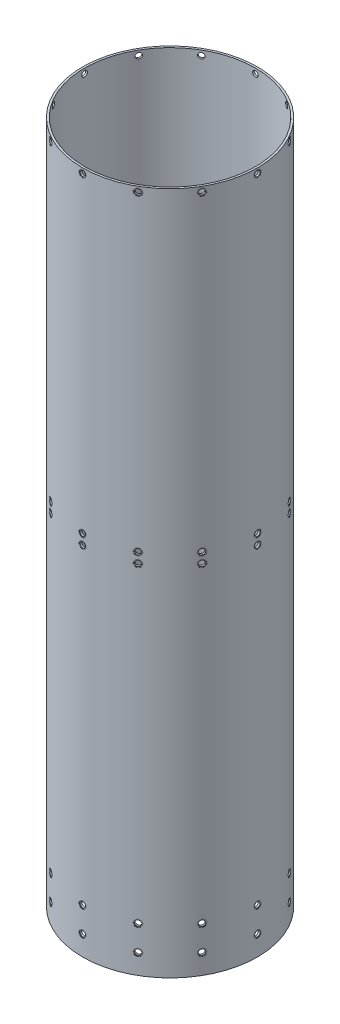
from build123d import *

# Parameters (mm, degrees)
SZKIC1_R                        = 87
SZKIC1_R_2                      = 85
DODANIE_WYCI_GNI_CIE2_DEPTH     = 680
WYTNIJ_WYCI_GNI_CIE1_REACH      = 709.28
WYTNIJ_WYCI_GNI_CIE1_END_RADIUS = 85
SZKIC3_R                        = 2.75
SZYK_KO_OWY1_COUNT              = 12
SZKIC4_R                        = 3.55
WYTNIJ_WYCI_GNI_CIE2_DEPTH      = 0.2
SZYK_KO_OWY2_COUNT              = 12
WYTNIJ_WYCI_GNI_CIE3_REACH      = 709.28
WYTNIJ_WYCI_GNI_CIE3_END_RADIUS = 85
SZKIC5_R                        = 2.75
SZKIC5_3_R                      = 3.55
SZKIC5_3_R_2                    = 2.75
WYTNIJ_WYCI_GNI_CIE4_DEPTH      = 0.2
SZYK_KO_OWY3_COUNT              = 12
SZYK_START                      = -87.000000044
SZYK_LINIOWY1_OUTLINE_R         = 2.75
SZYK_LINIOWY1_DEPTH             = 174.000000088
SZYK_LINIOWY1_2_OUTLINE_R       = 3.55
SZYK_LINIOWY1_2_OUTLINE_R_2     = 2.75
SZYK_LINIOWY1_2_DEPTH           = 0.200000044
SZYK_START_2                    = 86.8
SZYK_LINIOWY1_3_OUTLINE_R       = 3.55
SZYK_LINIOWY1_3_OUTLINE_R_2     = 2.75
SZYK_LINIOWY1_3_DEPTH           = 0.200000044
SZYK_LINIOWY1_4_OUTLINE_R       = 2.75
SZYK_LINIOWY1_4_DEPTH           = 174.000000088
SZYK_LINIOWY1_5_OUTLINE_R       = 3.55
SZYK_LINIOWY1_5_OUTLINE_R_2     = 2.75
SZYK_LINIOWY1_5_DEPTH           = 0.200000044
SZYK_LINIOWY1_6_OUTLINE_R       = 3.55
SZYK_LINIOWY1_6_OUTLINE_R_2     = 2.75
SZYK_LINIOWY1_6_DEPTH           = 0.200000044
SZYK_START_3                    = -87.000000101
SZYK_LINIOWY1_7_OUTLINE_R       = 2.75
SZYK_LINIOWY1_7_DEPTH           = 174.000000145
SZYK_LINIOWY1_8_OUTLINE_R       = 3.55
SZYK_LINIOWY1_8_OUTLINE_R_2     = 2.75
SZYK_LINIOWY1_8_DEPTH           = 0.200000101
SZYK_LINIOWY1_9_OUTLINE_R       = 3.55
SZYK_LINIOWY1_9_OUTLINE_R_2     = 2.75
SZYK_LINIOWY1_9_DEPTH           = 0.200000044
SZYK_LINIOWY1_10_OUTLINE_R      = 2.75
SZYK_LINIOWY1_10_DEPTH          = 174.000000088
SZYK_LINIOWY1_11_OUTLINE_R      = 3.55
SZYK_LINIOWY1_11_OUTLINE_R_2    = 2.75
SZYK_LINIOWY1_11_DEPTH          = 0.200000044
SZYK_LINIOWY1_12_OUTLINE_R      = 3.55
SZYK_LINIOWY1_12_OUTLINE_R_2    = 2.75
SZYK_LINIOWY1_12_DEPTH          = 0.200000044
SZYK_LINIOWY1_13_OUTLINE_R      = 2.75
SZYK_LINIOWY1_13_DEPTH          = 174.000000088
SZYK_LINIOWY1_14_OUTLINE_R      = 3.55
SZYK_LINIOWY1_14_OUTLINE_R_2    = 2.75
SZYK_LINIOWY1_14_DEPTH          = 0.200000044
SZYK_LINIOWY1_15_OUTLINE_R      = 3.55
SZYK_LINIOWY1_15_OUTLINE_R_2    = 2.75
SZYK_LINIOWY1_15_DEPTH          = 0.200000044
SZYK_LINIOWY1_16_OUTLINE_R      = 2.75
SZYK_LINIOWY1_16_DEPTH          = 174.000000088
SZYK_LINIOWY1_17_OUTLINE_R      = 3.55
SZYK_LINIOWY1_17_OUTLINE_R_2    = 2.75
SZYK_LINIOWY1_17_DEPTH          = 0.200000044
SZYK_LINIOWY1_18_OUTLINE_R      = 3.55
SZYK_LINIOWY1_18_OUTLINE_R_2    = 2.75
SZYK_LINIOWY1_18_DEPTH          = 0.200000044
SZYK_LINIOWY2_OUTLINE_R         = 2.75
SZYK_LINIOWY2_DEPTH             = 174.000000088
SZYK_LINIOWY2_2_OUTLINE_R       = 3.55
SZYK_LINIOWY2_2_OUTLINE_R_2     = 2.75
SZYK_LINIOWY2_2_DEPTH           = 0.200000044
SZYK_LINIOWY2_3_OUTLINE_R       = 3.55
SZYK_LINIOWY2_3_OUTLINE_R_2     = 2.75
SZYK_LINIOWY2_3_DEPTH           = 0.200000044
SZYK_LINIOWY2_4_OUTLINE_R       = 2.75
SZYK_LINIOWY2_4_DEPTH           = 174.000000088
SZYK_LINIOWY2_5_OUTLINE_R       = 3.55
SZYK_LINIOWY2_5_OUTLINE_R_2     = 2.75
SZYK_LINIOWY2_5_DEPTH           = 0.200000044
SZYK_LINIOWY2_6_OUTLINE_R       = 3.55
SZYK_LINIOWY2_6_OUTLINE_R_2     = 2.75
SZYK_LINIOWY2_6_DEPTH           = 0.200000044
SZYK_LINIOWY2_7_OUTLINE_R       = 2.75
SZYK_LINIOWY2_7_DEPTH           = 174.000000145
SZYK_LINIOWY2_8_OUTLINE_R       = 3.55
SZYK_LINIOWY2_8_OUTLINE_R_2     = 2.75
SZYK_LINIOWY2_8_DEPTH           = 0.200000101
SZYK_LINIOWY2_9_OUTLINE_R       = 3.55
SZYK_LINIOWY2_9_OUTLINE_R_2     = 2.75
SZYK_LINIOWY2_9_DEPTH           = 0.200000044
SZYK_LINIOWY2_10_OUTLINE_R      = 2.75
SZYK_LINIOWY2_10_DEPTH          = 174.000000088
SZYK_LINIOWY2_11_OUTLINE_R      = 3.55
SZYK_LINIOWY2_11_OUTLINE_R_2    = 2.75
SZYK_LINIOWY2_11_DEPTH          = 0.200000044
SZYK_LINIOWY2_12_OUTLINE_R      = 3.55
SZYK_LINIOWY2_12_OUTLINE_R_2    = 2.75
SZYK_LINIOWY2_12_DEPTH          = 0.200000044
SZYK_LINIOWY2_13_OUTLINE_R      = 2.75
SZYK_LINIOWY2_13_DEPTH          = 174.000000088
SZYK_LINIOWY2_14_OUTLINE_R      = 3.55
SZYK_LINIOWY2_14_OUTLINE_R_2    = 2.75
SZYK_LINIOWY2_14_DEPTH          = 0.200000044
SZYK_LINIOWY2_15_OUTLINE_R      = 3.55
SZYK_LINIOWY2_15_OUTLINE_R_2    = 2.75
SZYK_LINIOWY2_15_DEPTH          = 0.200000044
SZYK_LINIOWY2_16_OUTLINE_R      = 2.75
SZYK_LINIOWY2_16_DEPTH          = 174.000000088
SZYK_LINIOWY2_17_OUTLINE_R      = 3.55
SZYK_LINIOWY2_17_OUTLINE_R_2    = 2.75
SZYK_LINIOWY2_17_DEPTH          = 0.200000044
SZYK_LINIOWY2_18_OUTLINE_R      = 3.55
SZYK_LINIOWY2_18_OUTLINE_R_2    = 2.75
SZYK_LINIOWY2_18_DEPTH          = 0.200000044


# Read off the part's stored shape, not the designer's step: Szyk liniowy1, Szyk liniowy2
with BuildPart() as part:
    # Szkic1 → Dodanie-wyciągnięcie2 (new body)
    with BuildSketch(Plane(origin=(0, 0, 0), x_dir=(1, 0, 0), z_dir=(0, 1, 0))):
        with Locations(Location((0, 0, 0), (0, 0, 270))):
            Circle(SZKIC1_R)
        with Locations(Location((0, 0, 0), (0, 0, 270))):
            Circle(SZKIC1_R_2, mode=Mode.SUBTRACT)
    extrude(amount=DODANIE_WYCI_GNI_CIE2_DEPTH)

    # Wytnij-wyciągnięcie1: up to this cylinder (the profile starts outside it)
    wytnij_wyci_gni_cie1_end = Plane(origin=(0, 32.5, 0), z_dir=(0, -1, 0)) * Cylinder(WYTNIJ_WYCI_GNI_CIE1_END_RADIUS, 1614.56, mode=Mode.PRIVATE)
    # Szkic3 → Wytnij-wyciągnięcie1 (cut, up to the surface)
    with BuildSketch(Plane.XY.offset(87), mode=Mode.PRIVATE) as wytnij_wyci_gni_cie1_sk1:
        with Locations((0, 20)):
            Circle(SZKIC3_R)
    wytnij_wyci_gni_cie1_tool1 = extrude(wytnij_wyci_gni_cie1_sk1.sketch, amount=-WYTNIJ_WYCI_GNI_CIE1_REACH, mode=Mode.PRIVATE) - wytnij_wyci_gni_cie1_end
    # Szkic3 → Wytnij-wyciągnięcie1 (cut, up to the surface)
    with BuildSketch(Plane.XY.offset(87), mode=Mode.PRIVATE) as wytnij_wyci_gni_cie1_sk2:
        with Locations((0, 45)):
            Circle(SZKIC3_R)
    wytnij_wyci_gni_cie1_tool2 = extrude(wytnij_wyci_gni_cie1_sk2.sketch, amount=-WYTNIJ_WYCI_GNI_CIE1_REACH, mode=Mode.PRIVATE) - wytnij_wyci_gni_cie1_end
    wytnij_wyci_gni_cie1 = wytnij_wyci_gni_cie1_tool1.solids().sort_by_distance((0, 20, 87))[0] + wytnij_wyci_gni_cie1_tool2.solids().sort_by_distance((0, 45, 87))[0]
    add(wytnij_wyci_gni_cie1, mode=Mode.SUBTRACT)

    # Szyk kołowy1: Wytnij-wyciągnięcie1 ×12 about axis
    szyk_ko_owy1_axis = Axis((0, 680, 0), (0, -1, 0))
    for i in range(1, SZYK_KO_OWY1_COUNT):
        add(wytnij_wyci_gni_cie1.rotate(szyk_ko_owy1_axis, i * 360 / SZYK_KO_OWY1_COUNT), mode=Mode.SUBTRACT)

    # Szkic4 → Wytnij-wyciągnięcie2 (cut)
    with BuildSketch(Plane.XY.offset(87)):
        with Locations((0, 45)):
            Circle(SZKIC4_R)
        with Locations((0, 20)):
            Circle(SZKIC4_R)
    wytnij_wyci_gni_cie2 = extrude(amount=-WYTNIJ_WYCI_GNI_CIE2_DEPTH, mode=Mode.SUBTRACT)

    # Szyk kołowy2: Wytnij-wyciągnięcie2 ×12 about axis
    szyk_ko_owy2_axis = Axis((0, 0, 0), (0, 1, 0))
    for i in range(1, SZYK_KO_OWY2_COUNT):
        add(wytnij_wyci_gni_cie2.rotate(szyk_ko_owy2_axis, i * 360 / SZYK_KO_OWY2_COUNT), mode=Mode.SUBTRACT)

    # Wytnij-wyciągnięcie3: up to this cylinder (the profile starts outside it)
    wytnij_wyci_gni_cie3_end = Plane(origin=(0, 355.02, 0), z_dir=(0, -1, 0)) * Cylinder(WYTNIJ_WYCI_GNI_CIE3_END_RADIUS, 1589.56, mode=Mode.PRIVATE)
    # Szkic5 → Wytnij-wyciągnięcie3 (cut, up to the surface)
    with BuildSketch(Plane.XY.offset(87), mode=Mode.PRIVATE) as wytnij_wyci_gni_cie3_sk1:
        with Locations((0, 355.02)):
            Circle(SZKIC5_R)
    wytnij_wyci_gni_cie3_tool1 = extrude(wytnij_wyci_gni_cie3_sk1.sketch, amount=-WYTNIJ_WYCI_GNI_CIE3_REACH, mode=Mode.PRIVATE) - wytnij_wyci_gni_cie3_end
    wytnij_wyci_gni_cie3 = wytnij_wyci_gni_cie3_tool1.solids().sort_by_distance((0, 355.02, 87))[0]
    add(wytnij_wyci_gni_cie3, mode=Mode.SUBTRACT)

    # Szkic5<3> → Wytnij-wyciągnięcie4 (cut)
    with BuildSketch(Plane.XY.offset(87)):
        with Locations((0, 355.02)):
            Circle(SZKIC5_3_R)
        with Locations((0, 355.02)):
            Circle(SZKIC5_3_R_2, mode=Mode.SUBTRACT)
    wytnij_wyci_gni_cie4 = extrude(amount=-WYTNIJ_WYCI_GNI_CIE4_DEPTH, mode=Mode.SUBTRACT)

    # Szyk kołowy3: Wytnij-wyciągnięcie3, Wytnij-wyciągnięcie4 ×12 about axis
    szyk_ko_owy3_axis = Axis((0, 0, 0), (0, 1, 0))
    add([wytnij_wyci_gni_cie3.rotate(szyk_ko_owy3_axis, i * 360 / SZYK_KO_OWY3_COUNT) for i in range(1, SZYK_KO_OWY3_COUNT)], mode=Mode.SUBTRACT)
    add([wytnij_wyci_gni_cie4.rotate(szyk_ko_owy3_axis, i * 360 / SZYK_KO_OWY3_COUNT) for i in range(1, SZYK_KO_OWY3_COUNT)], mode=Mode.SUBTRACT)

    # Szyk liniowy1 outline → Szyk liniowy1 (cut)
    with BuildSketch(Plane(origin=(0, 0, 0), x_dir=(0.49999999999999195, 0, 0.8660254037844434), z_dir=(0.8660254037844433, 0, -0.4999999999999921)).offset(SZYK_START)):
        with Locations((0, -365.02)):
            Circle(SZYK_LINIOWY1_OUTLINE_R)
    extrude(amount=SZYK_LINIOWY1_DEPTH, mode=Mode.SUBTRACT)

    # Szyk liniowy1 2 outline → Szyk liniowy1 2 (cut)
    with BuildSketch(Plane(origin=(0, 0, 0), x_dir=(0.49999999999999195, 0, 0.8660254037844434), z_dir=(0.8660254037844433, 0, -0.4999999999999921)).offset(SZYK_START)):
        with Locations((0, -365.02)):
            Circle(SZYK_LINIOWY1_2_OUTLINE_R)
        with Locations((0, -365.02)):
            Circle(SZYK_LINIOWY1_2_OUTLINE_R_2, mode=Mode.SUBTRACT)
    extrude(amount=SZYK_LINIOWY1_2_DEPTH, mode=Mode.SUBTRACT)

    # Szyk liniowy1 3 outline → Szyk liniowy1 3 (cut)
    with BuildSketch(Plane(origin=(0, 0, 0), x_dir=(0.49999999999999195, 0, 0.8660254037844434), z_dir=(0.8660254037844433, 0, -0.4999999999999921)).offset(SZYK_START_2)):
        with Locations((0, -365.02)):
            Circle(SZYK_LINIOWY1_3_OUTLINE_R)
        with Locations((0, -365.02)):
            Circle(SZYK_LINIOWY1_3_OUTLINE_R_2, mode=Mode.SUBTRACT)
    extrude(amount=SZYK_LINIOWY1_3_DEPTH, mode=Mode.SUBTRACT)

    # Szyk liniowy1 4 outline → Szyk liniowy1 4 (cut)
    with BuildSketch(Plane(origin=(0, 0, 0), x_dir=(0.8660254037844346, 0, 0.5000000000000068), z_dir=(0.5000000000000068, 0, -0.8660254037844347)).offset(SZYK_START)):
        with Locations((0, -365.02)):
            Circle(SZYK_LINIOWY1_4_OUTLINE_R)
    extrude(amount=SZYK_LINIOWY1_4_DEPTH, mode=Mode.SUBTRACT)

    # Szyk liniowy1 5 outline → Szyk liniowy1 5 (cut)
    with BuildSketch(Plane(origin=(0, 0, 0), x_dir=(0.8660254037844346, 0, 0.5000000000000068), z_dir=(0.5000000000000068, 0, -0.8660254037844347)).offset(SZYK_START)):
        with Locations((0, -365.02)):
            Circle(SZYK_LINIOWY1_5_OUTLINE_R)
        with Locations((0, -365.02)):
            Circle(SZYK_LINIOWY1_5_OUTLINE_R_2, mode=Mode.SUBTRACT)
    extrude(amount=SZYK_LINIOWY1_5_DEPTH, mode=Mode.SUBTRACT)

    # Szyk liniowy1 6 outline → Szyk liniowy1 6 (cut)
    with BuildSketch(Plane(origin=(0, 0, 0), x_dir=(0.8660254037844346, 0, 0.5000000000000068), z_dir=(0.5000000000000068, 0, -0.8660254037844347)).offset(SZYK_START_2)):
        with Locations((0, -365.02)):
            Circle(SZYK_LINIOWY1_6_OUTLINE_R)
        with Locations((0, -365.02)):
            Circle(SZYK_LINIOWY1_6_OUTLINE_R_2, mode=Mode.SUBTRACT)
    extrude(amount=SZYK_LINIOWY1_6_DEPTH, mode=Mode.SUBTRACT)

    # Szyk liniowy1 7 outline → Szyk liniowy1 7 (cut)
    with BuildSketch(Plane.XY.offset(SZYK_START_3)):
        with Locations((0, 365.02)):
            Circle(SZYK_LINIOWY1_7_OUTLINE_R)
    extrude(amount=SZYK_LINIOWY1_7_DEPTH, mode=Mode.SUBTRACT)

    # Szyk liniowy1 8 outline → Szyk liniowy1 8 (cut)
    with BuildSketch(Plane.XY.offset(SZYK_START_3)):
        with Locations((0, 365.02)):
            Circle(SZYK_LINIOWY1_8_OUTLINE_R)
        with Locations((0, 365.02)):
            Circle(SZYK_LINIOWY1_8_OUTLINE_R_2, mode=Mode.SUBTRACT)
    extrude(amount=SZYK_LINIOWY1_8_DEPTH, mode=Mode.SUBTRACT)

    # Szyk liniowy1 9 outline → Szyk liniowy1 9 (cut)
    with BuildSketch(Plane.XY.offset(SZYK_START_2)):
        with Locations((0, 365.02)):
            Circle(SZYK_LINIOWY1_9_OUTLINE_R)
        with Locations((0, 365.02)):
            Circle(SZYK_LINIOWY1_9_OUTLINE_R_2, mode=Mode.SUBTRACT)
    extrude(amount=SZYK_LINIOWY1_9_DEPTH, mode=Mode.SUBTRACT)

    # Szyk liniowy1 10 outline → Szyk liniowy1 10 (cut)
    with BuildSketch(Plane(origin=(0, 0, 0), x_dir=(0.8660254037844416, 0, -0.4999999999999948), z_dir=(0.4999999999999948, 0, 0.8660254037844417)).offset(SZYK_START)):
        with Locations((0, 365.02)):
            Circle(SZYK_LINIOWY1_10_OUTLINE_R)
    extrude(amount=SZYK_LINIOWY1_10_DEPTH, mode=Mode.SUBTRACT)

    # Szyk liniowy1 11 outline → Szyk liniowy1 11 (cut)
    with BuildSketch(Plane(origin=(0, 0, 0), x_dir=(0.8660254037844416, 0, -0.4999999999999948), z_dir=(0.4999999999999948, 0, 0.8660254037844417)).offset(SZYK_START)):
        with Locations((0, 365.02)):
            Circle(SZYK_LINIOWY1_11_OUTLINE_R)
        with Locations((0, 365.02)):
            Circle(SZYK_LINIOWY1_11_OUTLINE_R_2, mode=Mode.SUBTRACT)
    extrude(amount=SZYK_LINIOWY1_11_DEPTH, mode=Mode.SUBTRACT)

    # Szyk liniowy1 12 outline → Szyk liniowy1 12 (cut)
    with BuildSketch(Plane(origin=(0, 0, 0), x_dir=(0.8660254037844416, 0, -0.4999999999999948), z_dir=(0.4999999999999948, 0, 0.8660254037844417)).offset(SZYK_START_2)):
        with Locations((0, 365.02)):
            Circle(SZYK_LINIOWY1_12_OUTLINE_R)
        with Locations((0, 365.02)):
            Circle(SZYK_LINIOWY1_12_OUTLINE_R_2, mode=Mode.SUBTRACT)
    extrude(amount=SZYK_LINIOWY1_12_DEPTH, mode=Mode.SUBTRACT)

    # Szyk liniowy1 13 outline → Szyk liniowy1 13 (cut)
    with BuildSketch(Plane(origin=(0, 0, 0), x_dir=(0.500000000000004, 0, -0.8660254037844363), z_dir=(0.8660254037844363, 0, 0.5000000000000042)).offset(SZYK_START)):
        with Locations((0, 365.02)):
            Circle(SZYK_LINIOWY1_13_OUTLINE_R)
    extrude(amount=SZYK_LINIOWY1_13_DEPTH, mode=Mode.SUBTRACT)

    # Szyk liniowy1 14 outline → Szyk liniowy1 14 (cut)
    with BuildSketch(Plane(origin=(0, 0, 0), x_dir=(0.500000000000004, 0, -0.8660254037844363), z_dir=(0.8660254037844363, 0, 0.5000000000000042)).offset(SZYK_START)):
        with Locations((0, 365.02)):
            Circle(SZYK_LINIOWY1_14_OUTLINE_R)
        with Locations((0, 365.02)):
            Circle(SZYK_LINIOWY1_14_OUTLINE_R_2, mode=Mode.SUBTRACT)
    extrude(amount=SZYK_LINIOWY1_14_DEPTH, mode=Mode.SUBTRACT)

    # Szyk liniowy1 15 outline → Szyk liniowy1 15 (cut)
    with BuildSketch(Plane(origin=(0, 0, 0), x_dir=(0.500000000000004, 0, -0.8660254037844363), z_dir=(0.8660254037844363, 0, 0.5000000000000042)).offset(SZYK_START_2)):
        with Locations((0, 365.02)):
            Circle(SZYK_LINIOWY1_15_OUTLINE_R)
        with Locations((0, 365.02)):
            Circle(SZYK_LINIOWY1_15_OUTLINE_R_2, mode=Mode.SUBTRACT)
    extrude(amount=SZYK_LINIOWY1_15_DEPTH, mode=Mode.SUBTRACT)

    # Szyk liniowy1 16 outline → Szyk liniowy1 16 (cut)
    with BuildSketch(Plane.YZ.offset(SZYK_START)):
        with Locations((365.02, 0)):
            Circle(SZYK_LINIOWY1_16_OUTLINE_R)
    extrude(amount=SZYK_LINIOWY1_16_DEPTH, mode=Mode.SUBTRACT)

    # Szyk liniowy1 17 outline → Szyk liniowy1 17 (cut)
    with BuildSketch(Plane.YZ.offset(SZYK_START)):
        with Locations((365.02, 0)):
            Circle(SZYK_LINIOWY1_17_OUTLINE_R)
        with Locations((365.02, 0)):
            Circle(SZYK_LINIOWY1_17_OUTLINE_R_2, mode=Mode.SUBTRACT)
    extrude(amount=SZYK_LINIOWY1_17_DEPTH, mode=Mode.SUBTRACT)

    # Szyk liniowy1 18 outline → Szyk liniowy1 18 (cut)
    with BuildSketch(Plane.YZ.offset(SZYK_START_2)):
        with Locations((365.02, 0)):
            Circle(SZYK_LINIOWY1_18_OUTLINE_R)
        with Locations((365.02, 0)):
            Circle(SZYK_LINIOWY1_18_OUTLINE_R_2, mode=Mode.SUBTRACT)
    extrude(amount=SZYK_LINIOWY1_18_DEPTH, mode=Mode.SUBTRACT)

    # Szyk liniowy2 outline → Szyk liniowy2 (cut)
    with BuildSketch(Plane(origin=(0, 0, 0), x_dir=(0.49999999999999195, 0, 0.8660254037844434), z_dir=(0.8660254037844433, 0, -0.4999999999999921)).offset(SZYK_START)):
        with Locations((0, -675.02)):
            Circle(SZYK_LINIOWY2_OUTLINE_R)
    extrude(amount=SZYK_LINIOWY2_DEPTH, mode=Mode.SUBTRACT)

    # Szyk liniowy2 2 outline → Szyk liniowy2 2 (cut)
    with BuildSketch(Plane(origin=(0, 0, 0), x_dir=(0.49999999999999195, 0, 0.8660254037844434), z_dir=(0.8660254037844433, 0, -0.4999999999999921)).offset(SZYK_START)):
        with Locations((0, -675.02)):
            Circle(SZYK_LINIOWY2_2_OUTLINE_R)
        with Locations((0, -675.02)):
            Circle(SZYK_LINIOWY2_2_OUTLINE_R_2, mode=Mode.SUBTRACT)
    extrude(amount=SZYK_LINIOWY2_2_DEPTH, mode=Mode.SUBTRACT)

    # Szyk liniowy2 3 outline → Szyk liniowy2 3 (cut)
    with BuildSketch(Plane(origin=(0, 0, 0), x_dir=(0.49999999999999195, 0, 0.8660254037844434), z_dir=(0.8660254037844433, 0, -0.4999999999999921)).offset(SZYK_START_2)):
        with Locations((0, -675.02)):
            Circle(SZYK_LINIOWY2_3_OUTLINE_R)
        with Locations((0, -675.02)):
            Circle(SZYK_LINIOWY2_3_OUTLINE_R_2, mode=Mode.SUBTRACT)
    extrude(amount=SZYK_LINIOWY2_3_DEPTH, mode=Mode.SUBTRACT)

    # Szyk liniowy2 4 outline → Szyk liniowy2 4 (cut)
    with BuildSketch(Plane(origin=(0, 0, 0), x_dir=(0.8660254037844346, 0, 0.5000000000000068), z_dir=(0.5000000000000068, 0, -0.8660254037844347)).offset(SZYK_START)):
        with Locations((0, -675.02)):
            Circle(SZYK_LINIOWY2_4_OUTLINE_R)
    extrude(amount=SZYK_LINIOWY2_4_DEPTH, mode=Mode.SUBTRACT)

    # Szyk liniowy2 5 outline → Szyk liniowy2 5 (cut)
    with BuildSketch(Plane(origin=(0, 0, 0), x_dir=(0.8660254037844346, 0, 0.5000000000000068), z_dir=(0.5000000000000068, 0, -0.8660254037844347)).offset(SZYK_START)):
        with Locations((0, -675.02)):
            Circle(SZYK_LINIOWY2_5_OUTLINE_R)
        with Locations((0, -675.02)):
            Circle(SZYK_LINIOWY2_5_OUTLINE_R_2, mode=Mode.SUBTRACT)
    extrude(amount=SZYK_LINIOWY2_5_DEPTH, mode=Mode.SUBTRACT)

    # Szyk liniowy2 6 outline → Szyk liniowy2 6 (cut)
    with BuildSketch(Plane(origin=(0, 0, 0), x_dir=(0.8660254037844346, 0, 0.5000000000000068), z_dir=(0.5000000000000068, 0, -0.8660254037844347)).offset(SZYK_START_2)):
        with Locations((0, -675.02)):
            Circle(SZYK_LINIOWY2_6_OUTLINE_R)
        with Locations((0, -675.02)):
            Circle(SZYK_LINIOWY2_6_OUTLINE_R_2, mode=Mode.SUBTRACT)
    extrude(amount=SZYK_LINIOWY2_6_DEPTH, mode=Mode.SUBTRACT)

    # Szyk liniowy2 7 outline → Szyk liniowy2 7 (cut)
    with BuildSketch(Plane.XY.offset(SZYK_START_3)):
        with Locations((0, 675.02)):
            Circle(SZYK_LINIOWY2_7_OUTLINE_R)
    extrude(amount=SZYK_LINIOWY2_7_DEPTH, mode=Mode.SUBTRACT)

    # Szyk liniowy2 8 outline → Szyk liniowy2 8 (cut)
    with BuildSketch(Plane.XY.offset(SZYK_START_3)):
        with Locations((0, 675.02)):
            Circle(SZYK_LINIOWY2_8_OUTLINE_R)
        with Locations((0, 675.02)):
            Circle(SZYK_LINIOWY2_8_OUTLINE_R_2, mode=Mode.SUBTRACT)
    extrude(amount=SZYK_LINIOWY2_8_DEPTH, mode=Mode.SUBTRACT)

    # Szyk liniowy2 9 outline → Szyk liniowy2 9 (cut)
    with BuildSketch(Plane.XY.offset(SZYK_START_2)):
        with Locations((0, 675.02)):
            Circle(SZYK_LINIOWY2_9_OUTLINE_R)
        with Locations((0, 675.02)):
            Circle(SZYK_LINIOWY2_9_OUTLINE_R_2, mode=Mode.SUBTRACT)
    extrude(amount=SZYK_LINIOWY2_9_DEPTH, mode=Mode.SUBTRACT)

    # Szyk liniowy2 10 outline → Szyk liniowy2 10 (cut)
    with BuildSketch(Plane(origin=(0, 0, 0), x_dir=(0.8660254037844416, 0, -0.4999999999999948), z_dir=(0.4999999999999948, 0, 0.8660254037844417)).offset(SZYK_START)):
        with Locations((0, 675.02)):
            Circle(SZYK_LINIOWY2_10_OUTLINE_R)
    extrude(amount=SZYK_LINIOWY2_10_DEPTH, mode=Mode.SUBTRACT)

    # Szyk liniowy2 11 outline → Szyk liniowy2 11 (cut)
    with BuildSketch(Plane(origin=(0, 0, 0), x_dir=(0.8660254037844416, 0, -0.4999999999999948), z_dir=(0.4999999999999948, 0, 0.8660254037844417)).offset(SZYK_START)):
        with Locations((0, 675.02)):
            Circle(SZYK_LINIOWY2_11_OUTLINE_R)
        with Locations((0, 675.02)):
            Circle(SZYK_LINIOWY2_11_OUTLINE_R_2, mode=Mode.SUBTRACT)
    extrude(amount=SZYK_LINIOWY2_11_DEPTH, mode=Mode.SUBTRACT)

    # Szyk liniowy2 12 outline → Szyk liniowy2 12 (cut)
    with BuildSketch(Plane(origin=(0, 0, 0), x_dir=(0.8660254037844416, 0, -0.4999999999999948), z_dir=(0.4999999999999948, 0, 0.8660254037844417)).offset(SZYK_START_2)):
        with Locations((0, 675.02)):
            Circle(SZYK_LINIOWY2_12_OUTLINE_R)
        with Locations((0, 675.02)):
            Circle(SZYK_LINIOWY2_12_OUTLINE_R_2, mode=Mode.SUBTRACT)
    extrude(amount=SZYK_LINIOWY2_12_DEPTH, mode=Mode.SUBTRACT)

    # Szyk liniowy2 13 outline → Szyk liniowy2 13 (cut)
    with BuildSketch(Plane(origin=(0, 0, 0), x_dir=(0.500000000000004, 0, -0.8660254037844363), z_dir=(0.8660254037844363, 0, 0.5000000000000042)).offset(SZYK_START)):
        with Locations((0, 675.02)):
            Circle(SZYK_LINIOWY2_13_OUTLINE_R)
    extrude(amount=SZYK_LINIOWY2_13_DEPTH, mode=Mode.SUBTRACT)

    # Szyk liniowy2 14 outline → Szyk liniowy2 14 (cut)
    with BuildSketch(Plane(origin=(0, 0, 0), x_dir=(0.500000000000004, 0, -0.8660254037844363), z_dir=(0.8660254037844363, 0, 0.5000000000000042)).offset(SZYK_START)):
        with Locations((0, 675.02)):
            Circle(SZYK_LINIOWY2_14_OUTLINE_R)
        with Locations((0, 675.02)):
            Circle(SZYK_LINIOWY2_14_OUTLINE_R_2, mode=Mode.SUBTRACT)
    extrude(amount=SZYK_LINIOWY2_14_DEPTH, mode=Mode.SUBTRACT)

    # Szyk liniowy2 15 outline → Szyk liniowy2 15 (cut)
    with BuildSketch(Plane(origin=(0, 0, 0), x_dir=(0.500000000000004, 0, -0.8660254037844363), z_dir=(0.8660254037844363, 0, 0.5000000000000042)).offset(SZYK_START_2)):
        with Locations((0, 675.02)):
            Circle(SZYK_LINIOWY2_15_OUTLINE_R)
        with Locations((0, 675.02)):
            Circle(SZYK_LINIOWY2_15_OUTLINE_R_2, mode=Mode.SUBTRACT)
    extrude(amount=SZYK_LINIOWY2_15_DEPTH, mode=Mode.SUBTRACT)

    # Szyk liniowy2 16 outline → Szyk liniowy2 16 (cut)
    with BuildSketch(Plane.YZ.offset(SZYK_START)):
        with Locations((675.02, 0)):
            Circle(SZYK_LINIOWY2_16_OUTLINE_R)
    extrude(amount=SZYK_LINIOWY2_16_DEPTH, mode=Mode.SUBTRACT)

    # Szyk liniowy2 17 outline → Szyk liniowy2 17 (cut)
    with BuildSketch(Plane.YZ.offset(SZYK_START)):
        with Locations((675.02, 0)):
            Circle(SZYK_LINIOWY2_17_OUTLINE_R)
        with Locations((675.02, 0)):
            Circle(SZYK_LINIOWY2_17_OUTLINE_R_2, mode=Mode.SUBTRACT)
    extrude(amount=SZYK_LINIOWY2_17_DEPTH, mode=Mode.SUBTRACT)

    # Szyk liniowy2 18 outline → Szyk liniowy2 18 (cut)
    with BuildSketch(Plane.YZ.offset(SZYK_START_2)):
        with Locations((675.02, 0)):
            Circle(SZYK_LINIOWY2_18_OUTLINE_R)
        with Locations((675.02, 0)):
            Circle(SZYK_LINIOWY2_18_OUTLINE_R_2, mode=Mode.SUBTRACT)
    extrude(amount=SZYK_LINIOWY2_18_DEPTH, mode=Mode.SUBTRACT)


solid = part.part
